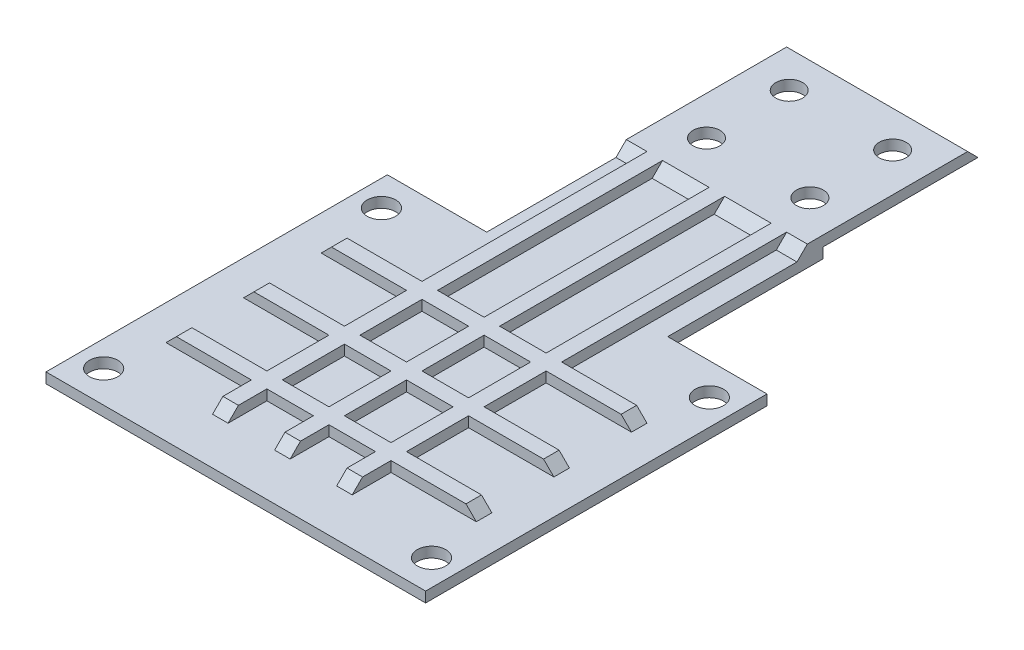
from build123d import *

# Parameters (mm, degrees)
SKETCH1_R                = 2.75
BOSS_EXTRUDE1_DEPTH      = 2
SKETCH2_W                = 3
SKETCH2_H                = 100
BOSS_EXTRUDE2_DEPTH      = 2
SKETCH3_W                = 60
SKETCH3_H                = 3
BOSS_EXTRUDE3_DEPTH      = 2
CHAMFER1_SIZE            = 2
CHAMFER1_OF_MIRROR1_SIZE = 2
SKETCH5_W                = 35
SKETCH5_H                = 30
BOSS_EXTRUDE4_DEPTH      = 2
CHAMFER2_SIZE            = 3
CUT_EXTRUDE1_DEPTH       = 122.80201158
CUT_EXTRUDE1_DEPTH_BACK  = 122.80201158
CUT_EXTRUDE2_DEPTH       = 116.086836888
CUT_EXTRUDE2_DEPTH_BACK  = 116.086836888
SKETCH7_R                = 2.6
BOSS_EXTRUDE5_DEPTH      = 35
CUT_EXTRUDE3_DEPTH       = 116.086836888
CUT_EXTRUDE3_DEPTH_BACK  = 116.086836888
SKETCH9_W                = 3
SKETCH9_H                = 2


# Some blends are built 0.0001 mm under size
with BuildPart() as part:
    # Sketch1 → Boss-Extrude1 (new body)
    with BuildSketch(Plane(origin=(0, 0, 0), x_dir=(1, 0, 0), z_dir=(0, 1, 0))):
        Polygon((-17.5, 42.995), (-17.5, -42.995), (-36.7, -42.995), (-36.7, -109.005), (36.7, -109.005), (36.7, -42.995), (17.5, -42.995), (17.5, 42.995), (36.7, 42.995), (36.7, 109.005), (-36.7, 109.005), (-36.7, 42.995), align=None)
        with Locations(Location((-31.7, 102.855, 0), (0, 0, 270))):
            Circle(SKETCH1_R, mode=Mode.SUBTRACT)
        with Locations(Location((-31.7, 49.145, 0), (0, 0, 270))):
            Circle(SKETCH1_R, mode=Mode.SUBTRACT)
        with Locations(Location((31.7, 49.145, 0), (0, 0, 270))):
            Circle(SKETCH1_R, mode=Mode.SUBTRACT)
        with Locations(Location((31.7, 102.855, 0), (0, 0, 270))):
            Circle(SKETCH1_R, mode=Mode.SUBTRACT)
        with Locations(Location((31.7, -102.855, 0), (0, 0, 270))):
            Circle(SKETCH1_R, mode=Mode.SUBTRACT)
        with Locations(Location((31.7, -49.145, 0), (0, 0, 270))):
            Circle(SKETCH1_R, mode=Mode.SUBTRACT)
        with Locations(Location((-31.7, -49.145, 0), (0, 0, 270))):
            Circle(SKETCH1_R, mode=Mode.SUBTRACT)
        with Locations(Location((-31.7, -102.855, 0), (0, 0, 270))):
            Circle(SKETCH1_R, mode=Mode.SUBTRACT)
    extrude(amount=BOSS_EXTRUDE1_DEPTH)

    # Sketch2 → Boss-Extrude2 (add)
    with BuildSketch(Plane(origin=(0, 2, 0), x_dir=(1, 0, 0), z_dir=(0, 1, 0))):
        with Locations((12, -50)):
            Rectangle(SKETCH2_W, SKETCH2_H)
        with Locations((0, -50)):
            Rectangle(SKETCH2_W, SKETCH2_H)
        with Locations((-12, -50)):
            Rectangle(SKETCH2_W, SKETCH2_H)
    boss_extrude2 = extrude(amount=BOSS_EXTRUDE2_DEPTH)

    # Sketch3 → Boss-Extrude3 (add)
    with BuildSketch(Plane(origin=(0, 2, 0), x_dir=(1, 0, 0), z_dir=(0, 1, 0))):
        with Locations((0, -91)):
            Rectangle(SKETCH3_W, SKETCH3_H)
        with Locations((0, -61)):
            Rectangle(SKETCH3_W, SKETCH3_H)
        with Locations((0, -76)):
            Rectangle(SKETCH3_W, SKETCH3_H)
    boss_extrude3 = extrude(amount=BOSS_EXTRUDE3_DEPTH)

    # Chamfer1
    chamfer1_edges = [part.edges().sort_by_distance(p)[0] for p in [
        (30, 4, 61),
        (30, 4, 76),
        (30, 4, 91),
        (12, 4, 100),
        (0, 4, 100),
        (-12, 4, 100),
        (-30, 4, 91),
        (-30, 4, 76),
        (-30, 4, 61),
    ]]
    chamfer(chamfer1_edges, length=CHAMFER1_SIZE - 0.0001)  # a hair under: the kernel refuses the full size

    # Mirror1: Boss-Extrude2, Boss-Extrude3 across plane
    add(boss_extrude2.mirror(Plane.XY))
    add(boss_extrude3.mirror(Plane.XY))

    # Chamfer1 of Mirror1
    chamfer1_of_mirror1_edges = [part.edges().sort_by_distance(p)[0] for p in [
        (30, 4, -61),
        (30, 4, -76),
        (30, 4, -91),
        (12, 4, -100),
        (0, 4, -100),
        (-12, 4, -100),
        (-30, 4, -91),
        (-30, 4, -76),
        (-30, 4, -61),
    ]]
    chamfer(chamfer1_of_mirror1_edges, length=CHAMFER1_OF_MIRROR1_SIZE - 0.0001)  # a hair under: the kernel refuses the full size

    # Sketch5 → Boss-Extrude4 (add)
    with BuildSketch(Plane(origin=(0, 4, 0), x_dir=(1, 0, 0), z_dir=(0, 1, 0))):
        Rectangle(SKETCH5_W, SKETCH5_H)
    extrude(amount=-BOSS_EXTRUDE4_DEPTH)

    # Chamfer2
    # the kernel refuses this chamfer: 3 mm, written as the material it adds along each edge
    with BuildSketch(Plane(origin=(17.5, 2, 15), x_dir=(0, 0.9996219169112969, -0.027495876610586202), z_dir=(-1, 0, 0))) as chamfer2_piece_1_section:
        Polygon((CHAMFER2_SIZE * 0.999621916911, -CHAMFER2_SIZE * 0.0274958766106), (-CHAMFER2_SIZE * 0.0274958766106, -CHAMFER2_SIZE * 0.999621916911), (0, 0), align=None)
    chamfer2_piece_1 = extrude(amount=11.715048964, mode=Mode.PRIVATE)
    chamfer2_piece_1 = split(chamfer2_piece_1, bisect_by=Plane(origin=(15.5, 4, 16.092091005), z_dir=(0, -1, 0)), keep=Keep.TOP, mode=Mode.PRIVATE)
    add(chamfer2_piece_1)
    with BuildSketch(Plane(origin=(18.215048964, 2, 15), x_dir=(0, 0.9996219169112969, -0.027495876610586202), z_dir=(-1, 0, 0))) as chamfer2_piece_2_section:
        Polygon((CHAMFER2_SIZE * 0.999621916911, -CHAMFER2_SIZE * 0.0274958766106), (-CHAMFER2_SIZE * 0.0274958766106, -CHAMFER2_SIZE * 0.999621916911), (0, 0), align=None)
    chamfer2_piece_2 = extrude(amount=24.430097928, mode=Mode.PRIVATE)
    chamfer2_piece_2 = split(chamfer2_piece_2, bisect_by=Plane(origin=(14, 4, 16.092091005), z_dir=(0, -1, 0)), keep=Keep.TOP, mode=Mode.PRIVATE)
    chamfer2_piece_2 = split(chamfer2_piece_2, bisect_by=Plane(origin=(17.5, 2.79312586, 16.092091005), z_dir=(-1, 0, 0)), keep=Keep.TOP, mode=Mode.PRIVATE)
    add(chamfer2_piece_2)
    with BuildSketch(Plane(origin=(6.215048964, 2, 15), x_dir=(0, 0.9996219169112969, -0.027495876610586202), z_dir=(-1, 0, 0))) as chamfer2_piece_3_section:
        Polygon((CHAMFER2_SIZE * 0.999621916911, -CHAMFER2_SIZE * 0.0274958766106), (-CHAMFER2_SIZE * 0.0274958766106, -CHAMFER2_SIZE * 0.999621916911), (0, 0), align=None)
    chamfer2_piece_3 = extrude(amount=24.430097928, mode=Mode.PRIVATE)
    chamfer2_piece_3 = split(chamfer2_piece_3, bisect_by=Plane(origin=(2.357524482, 4, 16.092091005), z_dir=(0, -1, 0)), keep=Keep.TOP, mode=Mode.PRIVATE)
    chamfer2_piece_3 = split(chamfer2_piece_3, bisect_by=Plane(origin=(-17.5, 2.79312586, 16.092091005), z_dir=(1, 0, 0)), keep=Keep.TOP, mode=Mode.PRIVATE)
    add(chamfer2_piece_3)
    with BuildSketch(Plane(origin=(-5.784951036, 2, 15), x_dir=(0, 0.9996219169112969, -0.027495876610586202), z_dir=(-1, 0, 0))) as chamfer2_piece_4_section:
        Polygon((CHAMFER2_SIZE * 0.999621916911, -CHAMFER2_SIZE * 0.0274958766106), (-CHAMFER2_SIZE * 0.0274958766106, -CHAMFER2_SIZE * 0.999621916911), (0, 0), align=None)
    chamfer2_piece_4 = extrude(amount=11.715048964, mode=Mode.PRIVATE)
    chamfer2_piece_4 = split(chamfer2_piece_4, bisect_by=Plane(origin=(-9.642475518, 4, 16.092091005), z_dir=(0, -1, 0)), keep=Keep.TOP, mode=Mode.PRIVATE)
    add(chamfer2_piece_4)

    # Sketch6 → Cut-Extrude1 (cut, two sides: drawn at the far end of the back side and taken through both)
    with BuildSketch(Plane(origin=(17.5, 0, 0), x_dir=(0, 0, -1), z_dir=(1, 0, 0)).offset(-CUT_EXTRUDE1_DEPTH_BACK)):
        Polygon((-13, 0), (-13, 2), (15, 2), (15, 4), (109.005, 4), (109.005, 0), align=None)
    extrude(amount=CUT_EXTRUDE1_DEPTH + CUT_EXTRUDE1_DEPTH_BACK, mode=Mode.SUBTRACT)

    # Sketch7 → Cut-Extrude2 (cut, two sides: drawn at the far end of the back side and taken through both)
    with BuildSketch(Plane(origin=(0, 4, 0), x_dir=(1, 0, 0), z_dir=(0, 1, 0)).offset(-CUT_EXTRUDE2_DEPTH_BACK)):
        with Locations(Location((-10, -8, 0), (0, 0, 270))):
            Circle(SKETCH7_R)
        with Locations(Location((-10, 8, 0), (0, 0, 270))):
            Circle(SKETCH7_R)
        with Locations(Location((10, 8, 0), (0, 0, 270))):
            Circle(SKETCH7_R)
        with Locations(Location((10, -8, 0), (0, 0, 270))):
            Circle(SKETCH7_R)
    extrude(amount=CUT_EXTRUDE2_DEPTH + CUT_EXTRUDE2_DEPTH_BACK, mode=Mode.SUBTRACT)

    # Sketch8 → Boss-Extrude5 (add)
    with BuildSketch(Plane(origin=(17.5, 0, 0), x_dir=(0, 0, -1), z_dir=(1, 0, 0))):
        Polygon((15, 4), (17, 2), (15, 2), align=None)
    extrude(amount=-BOSS_EXTRUDE5_DEPTH)

    # Sketch9 → Cut-Extrude3 (cut, two sides: drawn at the far end of the back side and taken through both)
    with BuildSketch(Plane(origin=(0, 4, 0), x_dir=(1, 0, 0), z_dir=(0, 1, 0)).offset(-CUT_EXTRUDE3_DEPTH_BACK)):
        with Locations((-12, 16)):
            Rectangle(SKETCH9_W, SKETCH9_H)
        with Locations((0, 16)):
            Rectangle(SKETCH9_W, SKETCH9_H)
        with Locations((12, 16)):
            Rectangle(SKETCH9_W, SKETCH9_H)
    extrude(amount=CUT_EXTRUDE3_DEPTH + CUT_EXTRUDE3_DEPTH_BACK, mode=Mode.SUBTRACT)


solid = part.part
